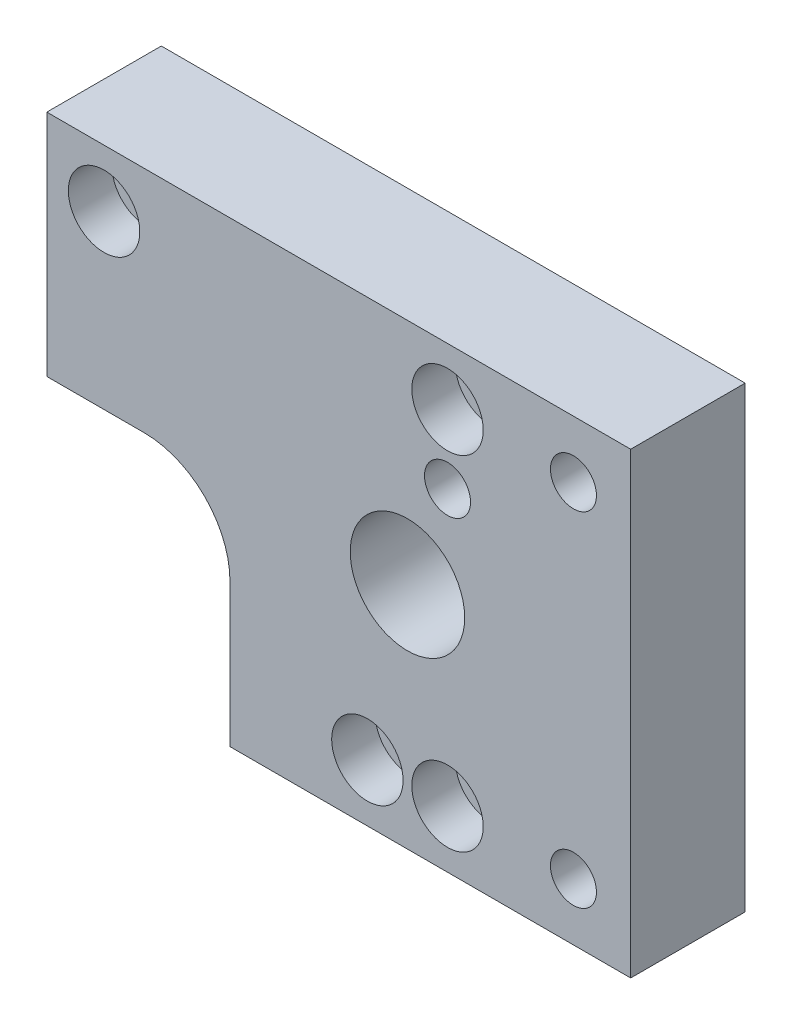
from build123d import *

# Parameters (mm, degrees)
SKETCH1_W                      = 64.77
SKETCH1_H                      = 50.8
SKETCH1_R                      = 2.5527
SKETCH1_R_2                    = 6.35
BOSS_EXTRUDE1_DEPTH            = 12.7
F_7_0_201_DIAMETER_HOLE1_D     = 5.1054
F_7_0_201_DIAMETER_HOLE1_DEPTH = 70.104
F_7_0_201_DIAMETER_HOLE1_TIP   = 1.533816902
SKETCH6_R                      = 3.9624
CUT_EXTRUDE1_DEPTH             = 4.826
SKETCH7_W                      = 20.32
SKETCH7_H                      = 25.4
CUT_EXTRUDE2_DEPTH             = 49.543247728
FILLET2_R                      = 9.525


with BuildPart() as part:
    # Sketch1 → Boss-Extrude1 (new body)
    with BuildSketch(Plane.XY):
        with Locations((6.985, 0)):
            Rectangle(SKETCH1_W, SKETCH1_H)
        with Locations((-19.05, 19.05)):
            Circle(SKETCH1_R, mode=Mode.SUBTRACT)
        with Locations((19.05, 19.05)):
            Circle(SKETCH1_R, mode=Mode.SUBTRACT)
        with Locations((19.05, -19.05)):
            Circle(SKETCH1_R, mode=Mode.SUBTRACT)
        with Locations((10.16, -19.05)):
            Circle(SKETCH1_R, mode=Mode.SUBTRACT)
        with Locations((14.605, 0)):
            Circle(SKETCH1_R_2, mode=Mode.SUBTRACT)
    extrude(amount=BOSS_EXTRUDE1_DEPTH)

    # #7 (0.201) Diameter Hole1
    with Locations(Plane(origin=(-24.721209515, -12.864288698, 0), x_dir=(1, 0, 0), z_dir=(0, 0, -1))):
        with Locations((57.741209515, 6.185711302), (57.741209515, -31.914288698), (43.771209515, -24.294288698)):
            Hole(F_7_0_201_DIAMETER_HOLE1_D / 2, depth=F_7_0_201_DIAMETER_HOLE1_DEPTH)
            with Locations((0, 0, -(F_7_0_201_DIAMETER_HOLE1_DEPTH + F_7_0_201_DIAMETER_HOLE1_TIP / 2))):  # 118° drill point
                Cone(0, F_7_0_201_DIAMETER_HOLE1_D / 2, F_7_0_201_DIAMETER_HOLE1_TIP, mode=Mode.SUBTRACT)

    # Sketch6 → Cut-Extrude1 (cut)
    with BuildSketch(Plane(origin=(0, 0, 12.7), x_dir=(-1, 0, 0), z_dir=(0, 0, -1))):
        with Locations((-19.05, 19.05)):
            Circle(SKETCH6_R)
        with Locations((-19.05, -19.05)):
            Circle(SKETCH6_R)
        with Locations((-10.16, -19.05)):
            Circle(SKETCH6_R)
        with Locations((19.05, 19.05)):
            Circle(SKETCH6_R)
    extrude(amount=CUT_EXTRUDE1_DEPTH, mode=Mode.SUBTRACT)

    # Sketch7 → Cut-Extrude2 (cut, through all)
    with BuildSketch(Plane(origin=(0, 0, 0), x_dir=(-1, 0, 0), z_dir=(0, 0, -1))):
        with Locations((15.24, -12.7)):
            Rectangle(SKETCH7_W, SKETCH7_H)
    extrude(amount=-CUT_EXTRUDE2_DEPTH, mode=Mode.SUBTRACT)

    # Fillet2
    fillet2_edges = [part.edges().sort_by_distance(p)[0] for p in [
        (-5.08, 0, 6.35),
    ]]
    fillet(fillet2_edges, radius=FILLET2_R)


solid = part.part
